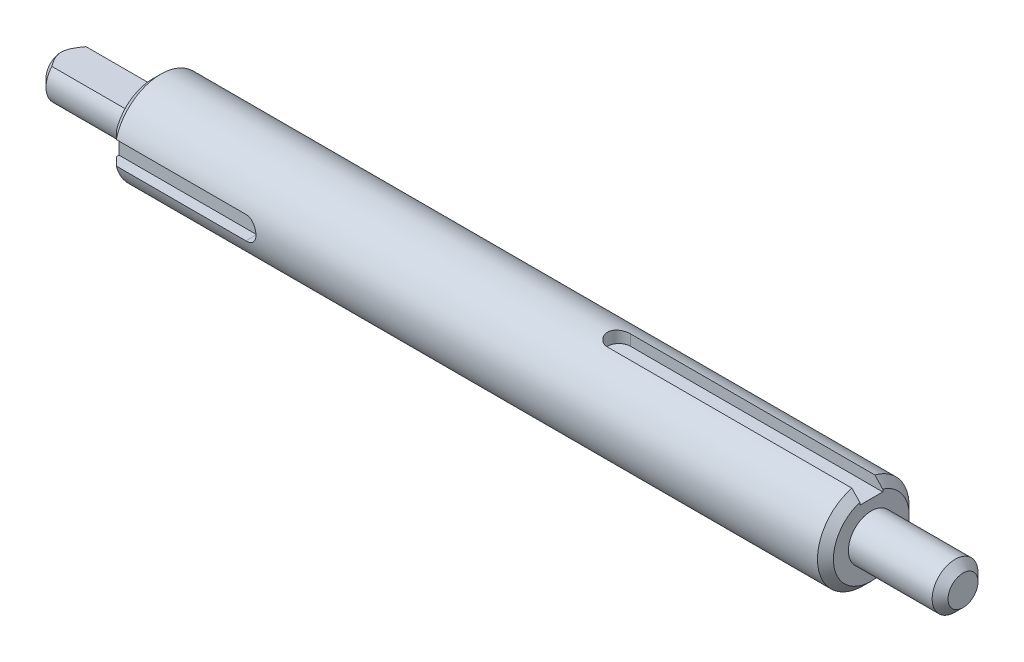
from build123d import *

# Parameters (mm, degrees)
BOSS_EXTRUDE1_DEPTH = 19.05
CUT_EXTRUDE1_START  = 6.985
CUT_EXTRUDE1_DEPTH  = 19.05
CUT_EXTRUDE2_START  = 6.985
CUT_EXTRUDE2_DEPTH  = 19.05


with BuildPart() as part:
    # Sketch1 → Revolve1 (revolve)
    with BuildSketch(Plane.XY, mode=Mode.PRIVATE) as revolve1_sk:
        Polygon((0, 0), (0, 9.525), (149.225, 9.525), (149.225, 4.7625), (168.275, 4.7625), (168.275, 0), align=None)
    revolve(revolve1_sk.sketch.rotate(Axis((0, 0, 0), (1, 0, 0)), 90), axis=Axis((0, 0, 0), (1, 0, 0)))

    # Sketch2 → Boss-Extrude1 (add)
    with BuildSketch(Plane.ZY):
        with BuildLine():
            Line((-3.549757914, 3.175), (3.549757914, 3.175))
            ThreePointArc((3.549757914, 3.175), (0, -4.7625), (-3.549757914, 3.175))
        make_face()
    extrude(amount=BOSS_EXTRUDE1_DEPTH)

    # Chamfer1: read off the stored shape, not the designer's step
    # Chamfer1 outline → Chamfer1 (revolve, cut)
    with BuildSketch(Plane.YX):
        Polygon((4.7625, 168.275), (3.1115, 168.275), (4.7625, 166.624), align=None)
        Polygon((9.525, 149.225), (7.874, 149.225), (9.525, 147.574), align=None)
        Polygon((9.525, 0), (9.525, 1.651), (7.874, 0), align=None)
        Polygon((4.7625, -19.05), (4.7625, -17.399), (3.1115, -19.05), align=None)
    revolve(axis=Axis((0, 0, 0), (1, 0, 0)), mode=Mode.SUBTRACT)

    # Sketch4 → Cut-Extrude1 (cut)
    with BuildSketch(Plane.XY.offset(CUT_EXTRUDE1_START)):
        with BuildLine():
            Line((0, 2.38125), (0, -2.38125))
            Line((0, -2.38125), (28.575, -2.38125))
            ThreePointArc((28.575, -2.38125), (30.95625, 0), (28.575, 2.38125))
            Line((28.575, 2.38125), (0, 2.38125))
        make_face()
    extrude(amount=CUT_EXTRUDE1_DEPTH, mode=Mode.SUBTRACT)

    # Sketch5 → Cut-Extrude2 (cut)
    with BuildSketch(Plane(origin=(0, 0, 0), x_dir=(1, 0, 0), z_dir=(0, 1, 0)).offset(CUT_EXTRUDE2_START)):
        with BuildLine():
            Line((149.225, 2.38125), (149.225, -2.38125))
            Line((149.225, -2.38125), (96.8248, -2.38125))
            ThreePointArc((96.8248, -2.38125), (94.44355, 0), (96.8248, 2.38125))
            Line((96.8248, 2.38125), (149.225, 2.38125))
        make_face()
    extrude(amount=CUT_EXTRUDE2_DEPTH, mode=Mode.SUBTRACT)


solid = part.part
